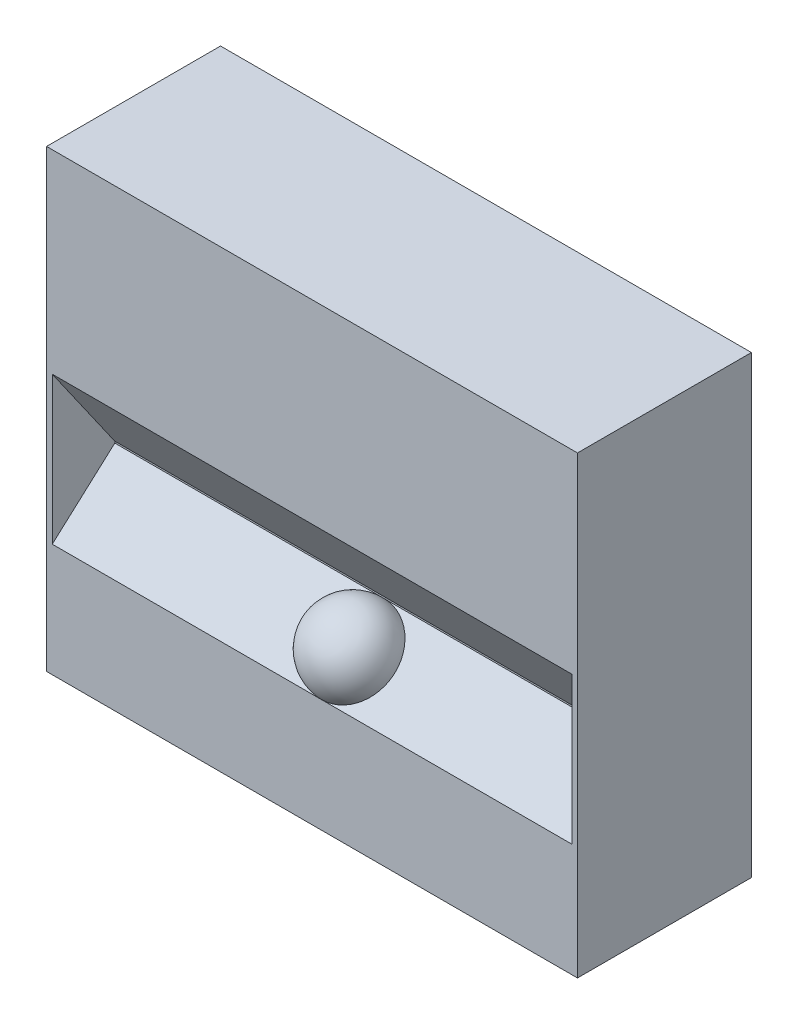
from build123d import *

# Parameters (mm, degrees)
ESQUISSE1_W             = 467
ESQUISSE1_H             = 400
BOSS_EXTRU_1_DEPTH      = 153
ESQUISSE2_W             = 457
ESQUISSE2_H             = 130
ENL_V_MAT_EXTRU_1_DEPTH = 55
CHANFREIN2_SIZE2        = 78.548140371
CHANFREIN2_SIZE         = 55
CHANFREIN3_SIZE         = 50
CHANFREIN3_SIZE_2       = 55.530625741
R_VOLUTION1_ANGLE       = 182


# Some blends are built 0.0001 mm under size
with BuildPart() as part:
    # Esquisse1 → Boss.-Extru.1 (new body)
    with BuildSketch(Plane.XY):
        with Locations((-32.653034301, 10.704485488)):
            Rectangle(ESQUISSE1_W, ESQUISSE1_H)
    extrude(amount=BOSS_EXTRU_1_DEPTH)

    # Esquisse2 → Enlèv. mat.-Extru.1 (cut)
    with BuildSketch(Plane.XY.offset(153)):
        with Locations((-32.653034301, -25.295514512)):
            Rectangle(ESQUISSE2_W, ESQUISSE2_H)
    extrude(amount=-ENL_V_MAT_EXTRU_1_DEPTH, mode=Mode.SUBTRACT)

    # Chanfrein2
    chanfrein2_edges = [part.edges().sort_by_distance(p)[0] for p in [
        (-32.653034301, 39.704485488, 98),
    ]]
    chanfrein2_side = [part.faces().sort_by_distance(p)[0] for p in [
        (-32.653034301, 39.704485488, 99.1),
    ]]
    chamfer(chanfrein2_edges, length=CHANFREIN2_SIZE - 0.0001, length2=CHANFREIN2_SIZE2 - 0.0001, reference=chanfrein2_side[0])  # a hair under: the kernel refuses the full size

    # Chanfrein3
    # the kernel refuses this chamfer: 55.530625741, 50 mm, written as the material it adds along each edge
    with BuildSketch(Plane(origin=(195.846965699, -90.295514512, 98), x_dir=(0, 0.9994864482690293, -0.03204434000819546), z_dir=(-1, 0, 0))) as chanfrein3_piece_1_section:
        Polygon((CHANFREIN3_SIZE * 0.999486448269, -CHANFREIN3_SIZE * 0.0320443400082), (-CHANFREIN3_SIZE_2 * 0.0320443400085, -CHANFREIN3_SIZE_2 * 0.999486448277), (0, 0), align=None)
    chanfrein3_piece_1 = extrude(amount=457, mode=Mode.PRIVATE)
    chanfrein3_piece_1 = split(chanfrein3_piece_1, bisect_by=Plane(origin=(-32.653034301, -73.821041767, 153), z_dir=(0, 0, -1)), keep=Keep.TOP, mode=Mode.PRIVATE)
    add(chanfrein3_piece_1)

    # Esquisse3 → Révolution1 (revolve)
    with BuildSketch(Plane(origin=(0, 26.477801513, 23.840719566), x_dir=(1, 0, 0), z_dir=(0, 0.7431448254773976, 0.6691306063588547))):
        with BuildLine():
            Line((-24.478047151, -173.800955084), (-24.478047151, -99.791154956))
            ThreePointArc((-24.478047151, -99.791154956), (-61.482947215, -136.79605502), (-24.478047151, -173.800955084))
        make_face()
    revolve(axis=Axis((-24.478047151, -89.817736948, 153), (0, 0.6691306063588548, -0.7431448254773975)), revolution_arc=R_VOLUTION1_ANGLE)


solid = part.part
